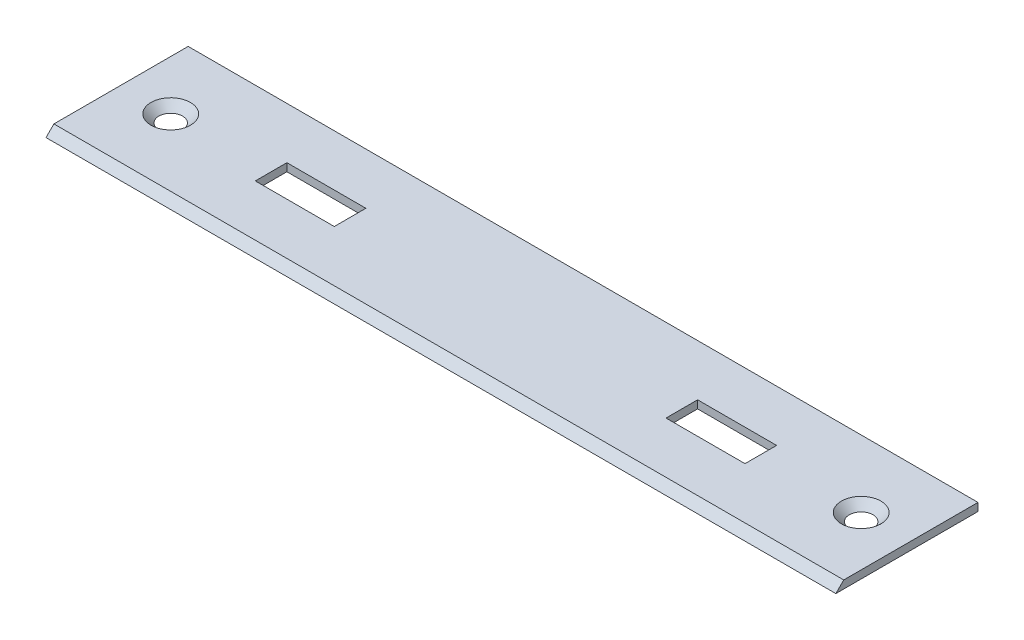
from build123d import *

# Parameters (mm, degrees)
SKETCH_1_W          = 100
SKETCH_1_H          = 18
EXTRUDE_1_DEPTH     = 1
CHAMFER_1_SIZE      = 1
SKETCH_2_W          = 10
SKETCH_2_H          = 4
CUT_EXTRUDE_1_DEPTH = 1
SKETCH_3_R          = 1.5
CUT_EXTRUDE_2_DEPTH = 20
CHAMFER_2_SIZE      = 1


with BuildPart() as part:
    # Эскиз1 → Бобышка-Вытянуть1 (new body)
    with BuildSketch(Plane(origin=(0, 0, 0), x_dir=(1, 0, 0), z_dir=(0, 1, 0))):
        Rectangle(SKETCH_1_W, SKETCH_1_H)
    extrude(amount=EXTRUDE_1_DEPTH)

    # Фаска1
    chamfer_1_edges = [part.edges().sort_by_distance(p)[0] for p in [
        (0, 1, 9),
    ]]
    chamfer(chamfer_1_edges, length=CHAMFER_1_SIZE - 0.0001)  # a hair under: the kernel refuses the full size

    # Эскиз2 → Вырез-Вытянуть1 (cut)
    with BuildSketch(Plane(origin=(0, 1, 0), x_dir=(1, 0, 0), z_dir=(0, 1, 0))):
        with Locations((-26, 0.5)):
            Rectangle(SKETCH_2_W, SKETCH_2_H)
        with Locations((26, 0.5)):
            Rectangle(SKETCH_2_W, SKETCH_2_H)
    extrude(amount=-CUT_EXTRUDE_1_DEPTH, mode=Mode.SUBTRACT)

    # Эскиз3 → Вырез-Вытянуть2 (cut)
    with BuildSketch(Plane(origin=(0, 1, 0), x_dir=(1, 0, 0), z_dir=(0, 1, 0))):
        with Locations(Location((-43.709679881, 0.5, 0), (0, 0, 270))):
            Circle(SKETCH_3_R)
        with Locations(Location((43.709679881, 0.5, 0), (0, 0, 90))):
            Circle(SKETCH_3_R)
    extrude(amount=-CUT_EXTRUDE_2_DEPTH, mode=Mode.SUBTRACT)

    # Фаска2
    chamfer_2_edges = [part.edges().sort_by_distance(p)[0] for p in [
        (-43.709679881, 1, -2),
        (43.709679881, 1, 1),
    ]]
    chamfer(chamfer_2_edges, length=CHAMFER_2_SIZE - 0.0001)  # a hair under: the kernel refuses the full size


solid = part.part
